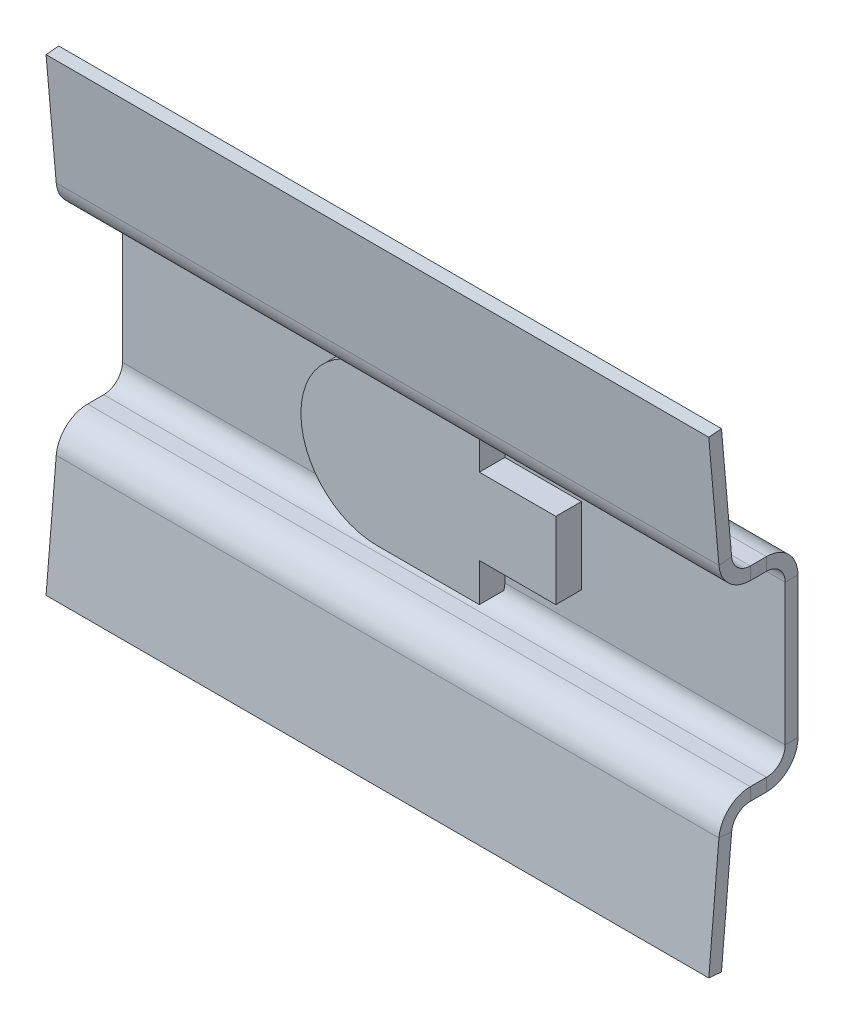
from build123d import *

# Parameters (mm, degrees)
BASE_FLANGE1_DEPTH  = 13
BOSS_EXTRUDE2_DEPTH = 1


# Sheet-metal steps are written as plain solids
with BuildPart() as part:
    # Sketch1 → Base-Flange1 (new, symmetric)
    with BuildSketch(Plane.YZ):
        with BuildLine():
            Line((-9.23, 3), (-4.67240108, 2.601261762))
            ThreePointArc((-4.67240108, 2.601261762), (-4.193521514, 2.365104494), (-4, 1.867464747))
            Line((-4, 1.867464747), (-4, 1.2366))
            ThreePointArc((-4, 1.2366), (-3.637808246, 0.362191754), (-2.7634, 0))
            Line((-2.7634, 0), (2.7634, 0))
            ThreePointArc((2.7634, 0), (3.637808246, 0.362191754), (4, 1.2366))
            Line((4, 1.2366), (4, 1.867464747))
            ThreePointArc((4, 1.867464747), (4.193521514, 2.365104494), (4.67240108, 2.601261762))
            Line((4.67240108, 2.601261762), (9.23, 3))
            Line((9.23, 3), (9.186422129, 3.498097349))
            Line((9.186422129, 3.498097349), (4.628823209, 3.099359111))
            ThreePointArc((4.628823209, 3.099359111), (3.824882845, 2.702899598), (3.5, 1.867464747))
            Line((3.5, 1.867464747), (3.5, 1.2366))
            ThreePointArc((3.5, 1.2366), (3.284254855, 0.715745145), (2.7634, 0.5))
            Line((2.7634, 0.5), (-2.7634, 0.5))
            ThreePointArc((-2.7634, 0.5), (-3.284254855, 0.715745145), (-3.5, 1.2366))
            Line((-3.5, 1.2366), (-3.5, 1.867464747))
            ThreePointArc((-3.5, 1.867464747), (-3.824882845, 2.702899598), (-4.628823209, 3.099359111))
            Line((-4.628823209, 3.099359111), (-9.186422129, 3.498097349))
            Line((-9.186422129, 3.498097349), (-9.23, 3))
        make_face()
    extrude(amount=BASE_FLANGE1_DEPTH, both=True)

    # Sketch6 → Boss-Extrude2 (add)
    with BuildSketch(Plane.XY.offset(0.5)):
        with BuildLine():
            Line((-2, 3), (2, 3))
            Line((2, 3), (2, 1.5))
            Line((2, 1.5), (5, 1.5))
            Line((5, 1.5), (5, -1.5))
            Line((5, -1.5), (2, -1.5))
            Line((2, -1.5), (2, -3))
            Line((2, -3), (-2, -3))
            ThreePointArc((-2, -3), (-5, 0), (-2, 3))
        make_face()
    extrude(amount=BOSS_EXTRUDE2_DEPTH)


solid = part.part
